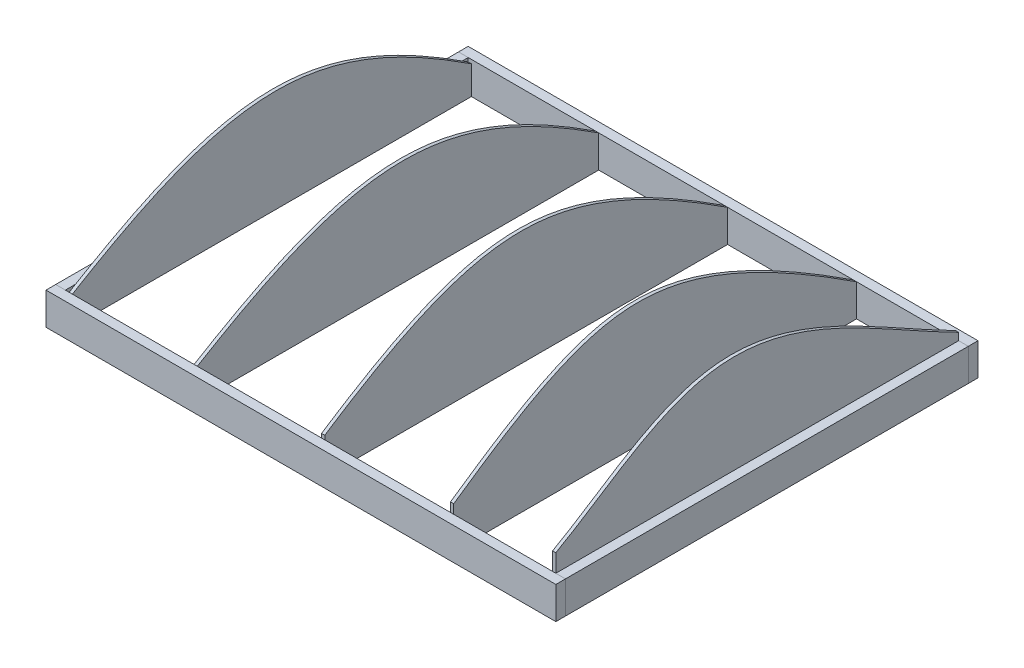
from build123d import *

# Parameters (mm, degrees)
MEMBER_20_X_20_1_DEPTH      = 1567
MEMBER_20_X_20_1_DEPTH_BACK = 15
SKETCH1_W                   = 30
SKETCH1_H                   = 100
SKETCH1_ON_SEGMENT_2_W      = 30
SKETCH1_ON_SEGMENT_2_H      = 100
MEMBER_20_X_20_1_2_DEPTH    = 1582
SKETCH1_ON_SEGMENT_3_W      = 30
SKETCH1_ON_SEGMENT_3_H      = 100
MEMBER_20_X_20_1_3_DEPTH    = 1282
SKETCH1_ON_SEGMENT_4_W      = 30
SKETCH1_ON_SEGMENT_4_H      = 100
MEMBER_20_X_20_1_4_DEPTH    = 1282
EXTRUDE_1_DEPTH             = 5
EXTRUDE_2_DEPTH             = 5
EXTRUDE_4_DEPTH             = 5
EXTRUDE_3_DEPTH             = 5
EXTRUDE_5_DEPTH             = 10
EXTRUDE_6_DEPTH             = 10
THICKEN_START               = 751
THICKEN_1_DEPTH             = 10
CUT_EXTRUDE_1_DEPTH         = 1129.034039006
CUT_EXTRUDE_1_DEPTH_BACK    = 1129.034039006
SKETCH_10_OUTSIDE_W         = 2064.662
SKETCH_10_OUTSIDE_H         = 1746.768
SKETCH_10_OUTSIDE_W_2       = 1522
SKETCH_10_OUTSIDE_H_2       = 1250
DELETE_START                = -761
DELETE_BODY_1_DEPTH         = 10


with BuildPart() as part:
    # Sketch1 → Member 20 X 20_1 (new, two sides: drawn at the far end of the back side and taken through both)
    with BuildSketch(Plane(origin=(-776, 0, -640), x_dir=(0, 0, -1), z_dir=(1, 0, 0)).offset(-MEMBER_20_X_20_1_DEPTH_BACK)):
        Rectangle(SKETCH1_W, SKETCH1_H)
    extrude(amount=MEMBER_20_X_20_1_DEPTH + MEMBER_20_X_20_1_DEPTH_BACK)


with BuildPart() as body_2:
    # Sketch1 on segment 2 (carried to segment 2) → Member 20 X 20_1 2 (new body)
    with BuildSketch(Plane(origin=(-791, 0, 640), x_dir=(0, 0, -1), z_dir=(1, 0, 0))):
        Rectangle(SKETCH1_ON_SEGMENT_2_W, SKETCH1_ON_SEGMENT_2_H)
    extrude(amount=MEMBER_20_X_20_1_2_DEPTH)


with BuildPart() as body_3:
    # Sketch1 on segment 3 (carried to segment 3) → Member 20 X 20_1 3 (new body)
    with BuildSketch(Plane(origin=(-776, 0, -641), x_dir=(1, 0, 0), z_dir=(0, 0, 1))):
        Rectangle(SKETCH1_ON_SEGMENT_3_W, SKETCH1_ON_SEGMENT_3_H)
    extrude(amount=MEMBER_20_X_20_1_3_DEPTH)

    # Member 20 X 20_1 3 end butt 1
    split(bisect_by=Plane(origin=(-776, 0, -625), x_dir=(0, -1, 0), z_dir=(0, 0, 1)), keep=Keep.TOP)

    # Member 20 X 20_1 3 end butt 2
    split(bisect_by=Plane(origin=(-776, 0, 625), x_dir=(0, 1, 0), z_dir=(0, 0, -1)), keep=Keep.TOP)


with BuildPart() as body_4:
    # Sketch1 on segment 4 (carried to segment 4) → Member 20 X 20_1 4 (new body)
    with BuildSketch(Plane(origin=(776, 0, -641), x_dir=(1, 0, 0), z_dir=(0, 0, 1))):
        Rectangle(SKETCH1_ON_SEGMENT_4_W, SKETCH1_ON_SEGMENT_4_H)
    extrude(amount=MEMBER_20_X_20_1_4_DEPTH)

    # Member 20 X 20_1 4 end butt 1
    split(bisect_by=Plane(origin=(776, 0, -625), x_dir=(0, -1, 0), z_dir=(0, 0, 1)), keep=Keep.TOP)

    # Member 20 X 20_1 4 end butt 2
    split(bisect_by=Plane(origin=(776, 0, 625), x_dir=(0, 1, 0), z_dir=(0, 0, -1)), keep=Keep.TOP)


with BuildPart() as body_5:
    # Эскиз4 → Бобышка-Вытянуть1 (new, symmetric)
    with BuildSketch(Plane(origin=(839, 0, 0), x_dir=(0, 0, -1), z_dir=(1, 0, 0))):
        with BuildLine():
            Line((-655, 80.257302063), (-655, -50))
            Line((-655, -50), (655, -50))
            Line((655, -50), (655, 48.860781094))
            add(Edge.make_bspline(
                [(655, 48.860781094), (407.54925547, 168.103359882), (159.338134303, 355.993204105), (-93.417741246, 346.880394236), (-100.140293463, 346.490653549), (-110.221664644, 345.684210073), (-113.581713958, 345.378583956), (-120.300981721, 344.69232081), (-123.655957487, 344.312101465), (-140.390025835, 342.22778496), (-153.664401165, 339.971996727), (-173.416917196, 335.759350508), (-179.974380313, 334.215926486), (-193.038546448, 330.864513272), (-199.55127132, 329.055428998), (-218.934200454, 323.274447734), (-231.671945707, 318.945871487), (-256.83927986, 309.494790773), (-269.265749415, 304.364249686), (-287.709299488, 296.163069915), (-293.824695876, 293.345730388), (-305.998331512, 287.563792758), (-312.057579583, 284.597340757), (-435.114041025, 222.682817953), (-538.304017908, 139.736286366), (-655, 80.257302063)],
                knots=[-2.161817402, -2.161817402, -2.161817402, -2.161817402, 0.125, 0.125, 0.1875, 0.1875, 0.21875, 0.21875, 0.25, 0.25, 0.375, 0.375, 0.4375, 0.4375, 0.5, 0.5, 0.625, 0.625, 0.75, 0.75, 0.8125, 0.8125, 0.875, 0.875, 2.090245738, 2.090245738, 2.090245738, 2.090245738], degree=3))
        make_face()
    extrude(amount=EXTRUDE_1_DEPTH, both=True)


with BuildPart() as body_6:
    # Эскиз5 → Бобышка-Вытянуть2 (new, symmetric)
    with BuildSketch(Plane(origin=(439, 0, 0), x_dir=(0, 0, -1), z_dir=(1, 0, 0))):
        with BuildLine():
            Line((654.999999997, 30.288253077), (655, -50))
            Line((655, -50), (-655, -50))
            Line((-655, -50), (-655, 57.74805179))
            add(Edge.make_bspline(
                [(654.999999997, 30.288253077), (624.45454615, 50.509351242), (593.715633072, 70.410797546), (542.507442256, 102.598074234), (522.184076469, 115.124994313), (481.278871267, 139.751759596), (460.696555479, 151.850817694), (429.583108507, 169.602897995), (419.172280775, 175.454697082), (398.262824285, 187.013221993), (387.765568238, 192.71845378), (366.688265431, 203.955272546), (356.106457613, 209.48770409), (334.847573275, 220.362769279), (324.170539668, 225.705488414), (302.707866351, 236.17455751), (291.922171784, 241.30079818), (270.228869486, 251.310399517), (259.318378906, 256.195071469), (237.395546017, 265.669121937), (226.379439676, 270.260610396), (204.2238994, 279.115396893), (193.084119485, 283.377774234), (170.662722254, 291.525081543), (159.381734125, 295.411685858), (142.338754236, 300.918271499), (136.637400021, 302.699617052), (125.190798931, 306.145504202), (119.444478644, 307.810246171), (102.172363416, 312.606757701), (90.602058306, 315.545184926), (67.337767193, 320.844951913), (55.643209266, 323.203623116), (37.995095843, 326.245750137), (32.094688961, 327.17719413), (20.256728971, 328.866760105), (14.316703035, 329.625509039), (-3.503906295, 331.621718754), (-15.402499497, 332.579794372), (-39.238768043, 333.694981527), (-51.176253721, 333.855980147), (-66.123703442, 333.532723565), (-69.115763359, 333.441750415), (-75.096119791, 333.207018899), (-78.083131438, 333.063336135), (-87.034703986, 332.553646941), (-92.989817302, 332.109122686), (-110.817917781, 330.466056829), (-122.65316104, 328.953829834), (-140.33292008, 326.077914738), (-146.214113233, 325.019048217), (-155.018206569, 323.283675666), (-157.950760231, 322.680449281), (-163.798909569, 321.427869041), (-166.715788638, 320.778277363), (-181.265076839, 317.416631272), (-192.792586837, 314.364881299), (-215.646981573, 307.611695241), (-226.97311986, 303.90784192), (-243.831110454, 297.927141584), (-249.428469722, 295.862426199), (-260.581424921, 291.597752932), (-266.139065193, 289.396962163), (-282.739295629, 282.609727152), (-293.690356034, 277.84623692), (-326.253241329, 262.957251266), (-347.580781665, 252.245634757), (-379.147474896, 235.302759202), (-389.60190056, 229.507331435), (-488.091388176, 173.448656483), (-571.181105103, 114.99498802), (-655, 57.74805179)],
                knots=[-0.033324686, -0.033324686, -0.033324686, -0.033324686, 0.0625, 0.0625, 0.125, 0.125, 0.1875, 0.1875, 0.21875, 0.21875, 0.25, 0.25, 0.28125, 0.28125, 0.3125, 0.3125, 0.34375, 0.34375, 0.375, 0.375, 0.40625, 0.40625, 0.4375, 0.4375, 0.46875, 0.46875, 0.484375, 0.484375, 0.5, 0.5, 0.53125, 0.53125, 0.5625, 0.5625, 0.578125, 0.578125, 0.59375, 0.59375, 0.625, 0.625, 0.65625, 0.65625, 0.6640625, 0.6640625, 0.671875, 0.671875, 0.6875, 0.6875, 0.71875, 0.71875, 0.734375, 0.734375, 0.7421875, 0.7421875, 0.75, 0.75, 0.78125, 0.78125, 0.8125, 0.8125, 0.828125, 0.828125, 0.84375, 0.84375, 0.875, 0.875, 0.9375, 0.9375, 0.96875, 0.96875, 1.233958266, 1.233958266, 1.233958266, 1.233958266], degree=3))
        make_face()
    extrude(amount=EXTRUDE_2_DEPTH, both=True)


with BuildPart() as body_7:
    # Эскиз6 → Бобышка-Вытянуть4 (new, symmetric)
    with BuildSketch(Plane(origin=(39, 0, 0), x_dir=(0, 0, -1), z_dir=(1, 0, 0))):
        with BuildLine():
            Line((655.000000002, 30.256188522), (655, -50))
            Line((655, -50), (-654.999999996, -50))
            Line((-654.999999996, -50), (-654.999999996, 42.412476024))
            add(Edge.make_bspline(
                [(655.000000002, 30.256188522), (622.167632396, 52.060746158), (589.069433143, 73.417486521), (543.951385473, 101.368897759), (532.25612267, 108.510362235), (508.765663168, 122.624943567), (496.970185265, 129.597586711), (473.264854776, 143.350198579), (461.354982231, 150.13013368), (437.408222455, 163.476036245), (425.370968285, 170.041385566), (407.204952916, 179.703878747), (401.130081932, 182.894381169), (388.948219476, 189.206113963), (382.841393184, 192.32745375), (364.470029782, 201.580943815), (352.154423091, 207.602162832), (314.974266971, 225.158976831), (289.879557325, 236.194627171), (258.00427707, 248.88813735), (251.602697885, 251.37172688), (238.766315979, 256.211807998), (232.32903269, 258.569298632), (212.956437878, 265.442759169), (199.960842907, 269.76122966), (173.785247703, 277.794025851), (160.605093931, 281.507848526), (140.679293457, 286.568907852), (134.011547585, 288.171361628), (120.621082972, 291.196168175), (113.894674461, 292.618999728), (80.218961052, 299.234999279), (53.071610473, 302.94832704), (22.262926274, 305.079374343), (18.836021152, 305.287757813), (11.974683432, 305.647026699), (8.540114155, 305.797881293), (-1.755514468, 306.162883112), (-8.614953582, 306.290059715), (-29.180269313, 306.321453894), (-42.873062451, 305.873331141), (-63.386342901, 304.503406202), (-70.219808163, 303.931102501), (-80.463637064, 302.901128856), (-83.877183497, 302.529172138), (-90.702161491, 301.728304845), (-94.112108873, 301.299545164), (-111.128175477, 299.018830302), (-124.65329635, 296.753723448), (-151.542125413, 291.413000485), (-164.905387722, 288.335145447), (-184.839640005, 283.162795012), (-191.469843239, 281.345278794), (-204.659580333, 277.544572191), (-211.222657111, 275.560564749), (-230.822573266, 269.37352874), (-243.770452854, 264.936419001), (-269.460635389, 255.521262747), (-282.202040462, 250.540853642), (-307.502558329, 240.100367139), (-320.061720768, 234.640420369), (-345.023429191, 223.308419698), (-357.43334635, 217.434393662), (-394.358000117, 199.328371568), (-418.597474761, 186.59748297), (-454.536652967, 166.765505887), (-466.446292537, 160.032097858), (-490.145265088, 146.354577683), (-501.934184524, 139.409741257), (-561.517621953, 103.677290546), (-608.484245157, 73.439707131), (-654.999999996, 42.412476024)],
                knots=[-0.027273286, -0.027273286, -0.027273286, -0.027273286, 0.0625, 0.0625, 0.09375, 0.09375, 0.125, 0.125, 0.15625, 0.15625, 0.1875, 0.1875, 0.203125, 0.203125, 0.21875, 0.21875, 0.25, 0.25, 0.3125, 0.3125, 0.328125, 0.328125, 0.34375, 0.34375, 0.375, 0.375, 0.40625, 0.40625, 0.421875, 0.421875, 0.4375, 0.4375, 0.5, 0.5, 0.5078125, 0.5078125, 0.515625, 0.515625, 0.53125, 0.53125, 0.5625, 0.5625, 0.578125, 0.578125, 0.5859375, 0.5859375, 0.59375, 0.59375, 0.625, 0.625, 0.65625, 0.65625, 0.671875, 0.671875, 0.6875, 0.6875, 0.71875, 0.71875, 0.75, 0.75, 0.78125, 0.78125, 0.8125, 0.8125, 0.875, 0.875, 0.90625, 0.90625, 0.9375, 0.9375, 1.064909144, 1.064909144, 1.064909144, 1.064909144], degree=3))
        make_face()
    extrude(amount=EXTRUDE_4_DEPTH, both=True)


with BuildPart() as body_8:
    # Эскиз9 → Бобышка-Вытянуть3 (new, symmetric)
    with BuildSketch(Plane(origin=(-361, 0, 0), x_dir=(0, 0, -1), z_dir=(1, 0, 0))):
        with BuildLine():
            Line((655, 30.204010373), (655, -50))
            Line((655, -50), (-655.000000001, -50))
            Line((-655.000000001, -50), (-655.000000001, 24.912697624))
            add(Edge.make_bspline(
                [(655, 30.204010373), (625.627362749, 49.812751725), (595.987006161, 68.956883079), (546.156128338, 99.691549979), (526.173104659, 111.642184428), (485.814351422, 134.86193708), (465.440316387, 146.133996019), (434.517708589, 162.414628135), (424.149897524, 167.736901824), (403.280541806, 178.149363003), (392.775163202, 183.240639384), (361.097366819, 198.096985903), (339.747748178, 207.455457855), (307.300640963, 220.494925665), (296.414317993, 224.674630592), (279.96792764, 230.668091734), (274.465522047, 232.62013462), (263.436803325, 236.422167642), (257.908512019, 238.272858428), (230.194388302, 247.263820004), (207.790445393, 253.616220234), (179.446988501, 260.333870402), (173.761358038, 261.616212158), (162.354989007, 264.054076269), (156.632196924, 265.209983988), (139.422944804, 268.47833035), (127.920544211, 270.386714391), (93.321084978, 275.267754301), (70.131499034, 277.393829007), (40.982091537, 278.565309643), (35.140045183, 278.725529147), (23.467516021, 278.896729931), (17.635699711, 278.907869082), (0.153504321, 278.719430741), (-11.483606474, 278.297750603), (-34.723310485, 276.87658802), (-46.325927145, 275.877498011), (-63.704857178, 273.960463333), (-69.49366463, 273.2516616), (-78.170740975, 272.08576578), (-81.063072404, 271.679872769), (-86.839755339, 270.835126659), (-89.724107544, 270.396289567), (-115.648019334, 266.301242623), (-138.44121208, 261.628255062), (-183.596480552, 250.503021917), (-205.959345405, 244.05403313), (-233.685457196, 235.054011351), (-239.221666162, 233.20623843), (-250.253774987, 229.427647938), (-255.751289064, 227.496648997), (-272.190775994, 221.584312268), (-283.079665007, 217.483570371), (-315.553601039, 204.747825295), (-336.946246668, 195.680044154), (-460.499988148, 140.076912831), (-558.063496756, 83.199982313), (-655.000000001, 24.912697624)],
                knots=[-0.03210545, -0.03210545, -0.03210545, -0.03210545, 0.0625, 0.0625, 0.125, 0.125, 0.1875, 0.1875, 0.21875, 0.21875, 0.25, 0.25, 0.3125, 0.3125, 0.34375, 0.34375, 0.359375, 0.359375, 0.375, 0.375, 0.4375, 0.4375, 0.453125, 0.453125, 0.46875, 0.46875, 0.5, 0.5, 0.5625, 0.5625, 0.578125, 0.578125, 0.59375, 0.59375, 0.625, 0.625, 0.65625, 0.65625, 0.671875, 0.671875, 0.6796875, 0.6796875, 0.6875, 0.6875, 0.75, 0.75, 0.8125, 0.8125, 0.828125, 0.828125, 0.84375, 0.84375, 0.875, 0.875, 0.9375, 0.9375, 1.239502448, 1.239502448, 1.239502448, 1.239502448], degree=3))
        make_face()
    extrude(amount=EXTRUDE_3_DEPTH, both=True)


with BuildPart() as body_9:
    # Эскиз11 → Бобышка-Вытянуть5 (new body)
    with BuildSketch(Plane(origin=(-761, 0, 0), x_dir=(0, 0, -1), z_dir=(1, 0, 0))):
        with BuildLine():
            Line((655, -50), (655, 30.204010373))
            add(Edge.make_bspline(
                [(655, 30.204010373), (625.627362749, 49.812751725), (595.987006161, 68.956883079), (546.156128338, 99.691549979), (526.173104659, 111.642184428), (485.814351422, 134.86193708), (465.440316387, 146.133996019), (434.517708589, 162.414628135), (424.149897524, 167.736901824), (403.280541806, 178.149363003), (392.775163202, 183.240639384), (361.097366819, 198.096985903), (339.747748178, 207.455457855), (307.300640963, 220.494925665), (296.414317993, 224.674630592), (279.96792764, 230.668091734), (274.465522047, 232.62013462), (263.436803325, 236.422167642), (257.908512019, 238.272858428), (230.194388302, 247.263820004), (207.790445393, 253.616220234), (179.446988501, 260.333870402), (173.761358038, 261.616212158), (162.354989007, 264.054076269), (156.632196924, 265.209983988), (139.422944804, 268.47833035), (127.920544211, 270.386714391), (93.321084978, 275.267754301), (70.131499034, 277.393829007), (40.982091537, 278.565309643), (35.140045183, 278.725529147), (23.467516021, 278.896729931), (17.635699711, 278.907869082), (0.153504321, 278.719430741), (-11.483606474, 278.297750603), (-34.723310485, 276.87658802), (-46.325927145, 275.877498011), (-63.704857178, 273.960463333), (-69.49366463, 273.2516616), (-78.170740975, 272.08576578), (-81.063072404, 271.679872769), (-86.839755339, 270.835126659), (-89.724107544, 270.396289567), (-115.648019334, 266.301242623), (-138.44121208, 261.628255062), (-183.596480552, 250.503021917), (-205.959345405, 244.05403313), (-233.685457196, 235.054011351), (-239.221666162, 233.20623843), (-250.253774987, 229.427647938), (-255.751289064, 227.496648997), (-272.190775994, 221.584312268), (-283.079665007, 217.483570371), (-315.553601039, 204.747825295), (-336.946246668, 195.680044154), (-460.499988148, 140.076912831), (-558.063496756, 83.199982313), (-655.000000001, 24.912697624)],
                knots=[-0.03210545, -0.03210545, -0.03210545, -0.03210545, 0.0625, 0.0625, 0.125, 0.125, 0.1875, 0.1875, 0.21875, 0.21875, 0.25, 0.25, 0.3125, 0.3125, 0.34375, 0.34375, 0.359375, 0.359375, 0.375, 0.375, 0.4375, 0.4375, 0.453125, 0.453125, 0.46875, 0.46875, 0.5, 0.5, 0.5625, 0.5625, 0.578125, 0.578125, 0.59375, 0.59375, 0.625, 0.625, 0.65625, 0.65625, 0.671875, 0.671875, 0.6796875, 0.6796875, 0.6875, 0.6875, 0.75, 0.75, 0.8125, 0.8125, 0.828125, 0.828125, 0.84375, 0.84375, 0.875, 0.875, 0.9375, 0.9375, 1.239502448, 1.239502448, 1.239502448, 1.239502448], degree=3))
            Line((-655.000000001, 24.912697624), (-655.000000001, -50))
            Line((-655.000000001, -50), (655, -50))
        make_face()
    extrude(amount=EXTRUDE_5_DEPTH)


with BuildPart() as body_10:
    # Эскиз12 → Бобышка-Вытянуть6 (new body)
    with BuildSketch(Plane.ZY.offset(-761)):
        with BuildLine():
            Line((655, -50), (655, 80.257302063))
            add(Edge.make_bspline(
                [(655, 80.257302063), (538.304017908, 139.736286366), (435.114041025, 222.682817953), (312.057579583, 284.597340757), (305.998331512, 287.563792758), (293.824695876, 293.345730388), (287.709299488, 296.163069915), (269.265749415, 304.364249686), (256.83927986, 309.494790773), (231.671945707, 318.945871487), (218.934200454, 323.274447734), (199.55127132, 329.055428998), (193.038546448, 330.864513272), (179.974380313, 334.215926486), (173.416917196, 335.759350508), (153.664401165, 339.971996727), (140.390025835, 342.22778496), (123.655957487, 344.312101465), (120.300981721, 344.69232081), (113.581713958, 345.378583956), (110.221664644, 345.684210073), (100.140293463, 346.490653549), (93.417741246, 346.880394236), (-159.338134303, 355.993204105), (-407.54925547, 168.103359882), (-655, 48.860781094)],
                knots=[-2.161817402, -2.161817402, -2.161817402, -2.161817402, -0.946571664, -0.946571664, -0.884071664, -0.884071664, -0.821571664, -0.821571664, -0.696571664, -0.696571664, -0.571571664, -0.571571664, -0.509071664, -0.509071664, -0.446571664, -0.446571664, -0.321571664, -0.321571664, -0.290321664, -0.290321664, -0.259071664, -0.259071664, -0.196571664, -0.196571664, 2.090245738, 2.090245738, 2.090245738, 2.090245738], degree=3))
            Line((-655, 48.860781094), (-655, -50))
            Line((-655, -50), (655, -50))
        make_face()
    extrude(amount=EXTRUDE_6_DEPTH)

    # Придать толщину1: read off the stored shape, not the designer's step
    # Придать толщину1 outline → Придать толщину1 (add)
    with BuildSketch(Plane.YZ.offset(THICKEN_START)):
        with BuildLine():
            add(Edge.make_bspline(
                [(87.3848746, 658.632865223), (98.440058955, 636.942925311), (110.094609525, 615.566533015), (122.263703742, 594.453825747), (134.861997451, 573.555289119), (147.803626127, 552.821504401), (161.002261008, 532.202975746), (174.371183376, 511.650016677), (187.82334987, 491.112682107), (201.271430495, 470.54073477), (214.627810782, 449.883642743), (227.804558331, 429.090606917), (240.713363627, 408.110624754), (253.265474015, 386.892599773), (266.884921045, 362.697126585), (268.391225187, 360.004224148), (269.890387289, 357.306705474), (271.382232938, 354.6044709), (272.866587598, 351.897420817), (274.343276605, 349.185455646), (275.812125178, 346.468475884), (277.272958402, 343.746382036), (278.725601248, 341.019074698), (280.169878555, 338.286454473), (281.605615045, 335.548422043), (283.032635309, 332.804878115), (284.450763819, 330.055723455), (286.035957557, 326.956500801), (286.211948517, 326.612053511), (286.387797455, 326.267516812), (286.563504029, 325.922890508), (286.739067895, 325.578174408), (286.914488711, 325.233368317), (287.08976613, 324.888472042), (287.264899815, 324.543485389), (287.439889415, 324.198408165), (287.614734595, 323.853240176), (287.789435005, 323.507981229), (287.963990306, 323.162631131), (288.138400153, 322.817189688), (288.486928252, 322.126123724), (288.661048222, 321.780495456), (288.835011593, 321.434797707), (289.00884591, 321.088971784), (289.182539096, 320.743041307), (289.35607895, 320.397030861), (289.529470854, 320.050929014), (289.702722923, 319.704718153), (289.875831311, 319.358405189), (290.048786679, 319.012008353), (290.221591151, 318.665522766), (290.394254449, 318.318927776), (290.566763528, 317.972249031), (291.083843233, 316.931928683), (291.427962214, 316.238011271), (291.771474843, 315.543728302), (292.114375588, 314.849084733), (292.456658916, 314.154085511), (292.798319301, 313.458735607), (293.139351204, 312.763039953), (293.479749103, 312.067003533), (293.819507457, 311.370631271), (294.158620744, 310.67392815), (294.497083426, 309.976899106), (294.834889975, 309.279549104), (295.172034859, 308.581883095), (295.59263197, 307.709411772), (295.676709692, 307.534898065), (295.760745627, 307.360364995), (295.84473969, 307.185812636), (295.928691792, 307.01124107), (296.012601849, 306.836650367), (296.096469774, 306.662040615), (296.180295479, 306.487411878), (296.264078879, 306.312764247), (296.347819888, 306.138097787), (296.431518417, 305.963412584), (296.515174382, 305.788708711), (296.598787696, 305.613986246), (296.724143559, 305.351874778), (296.765918163, 305.264499659), (296.807682071, 305.177119924), (296.849435272, 305.089735574), (296.891177759, 305.002346634), (296.932909514, 304.914953089), (296.974630536, 304.827554983), (297.016340803, 304.740152285), (297.058040314, 304.652745045), (297.099729052, 304.56533324), (297.141407008, 304.477916901), (297.183074173, 304.390496027), (297.224730533, 304.303070631), (297.287198854, 304.171925768), (297.308018922, 304.128209684), (297.328836291, 304.084492478), (297.34965094, 304.040774134), (297.370462907, 303.99705469), (297.391272126, 303.953334084), (297.412078684, 303.909612404), (297.43288248, 303.865889553), (297.453683606, 303.822165626), (297.474481986, 303.778440549), (297.49527767, 303.734714373), (297.516070627, 303.690987072), (297.536860869, 303.64725866), (297.568042151, 303.581664369), (297.578434674, 303.559800499), (297.588828918, 303.53793131), (297.599218974, 303.516069198), (297.609609044, 303.494205374), (297.620001147, 303.472335548), (297.630392042, 303.450466573), (297.640779379, 303.428603323), (297.651165839, 303.40674026), (297.661554972, 303.38486986), (297.671944567, 303.362996764), (297.68232904, 303.341132678), (297.692712523, 303.319269062), (297.713479428, 303.275538554), (297.723862222, 303.253673001), (297.734244357, 303.231807151), (297.744625831, 303.209940999), (297.75500665, 303.188074555), (297.765386802, 303.166207802), (297.775766304, 303.144340764), (297.786145137, 303.122473413), (297.796523318, 303.100605775), (297.806900833, 303.07873783), (297.817277691, 303.05686959), (297.827653888, 303.03500105), (297.838029425, 303.013132211), (298.014402319, 302.641356867), (298.180231246, 302.2913741), (298.345890552, 301.941314568), (298.511379706, 301.591178063), (298.676698186, 301.240964381), (298.841845446, 300.890673312), (299.006820982, 300.540304659), (299.171624231, 300.1898582), (299.336254701, 299.839333749), (299.500711828, 299.48873108), (299.664995108, 299.138050004), (299.829103997, 298.787290303), (299.993037972, 298.436451777), (300.484313557, 297.383699098), (300.811128841, 296.681547845), (301.137238105, 295.979078808), (301.462637109, 295.276290351), (301.787321598, 294.573180814), (302.111287339, 293.869748572), (302.434530074, 293.165991954), (302.757045569, 292.461909343), (303.07882957, 291.757499068), (303.399877837, 291.052759502), (303.720186121, 290.347688988), (304.03975018, 289.642285888), (304.358565767, 288.936548553), (304.756144353, 288.053957036), (304.835613024, 287.877417739), (304.915034586, 287.700857428), (304.994408963, 287.524276066), (305.073736108, 287.347673649), (305.15301592, 287.171050115), (305.232248383, 286.994405489), (305.31143337, 286.817739687), (305.390570876, 286.64105274), (305.469660781, 286.464344575), (305.548703058, 286.2876152), (305.627697617, 286.11086457), (305.706644402, 285.934092668), (305.805268079, 285.713101164), (305.824989826, 285.668901533), (305.844708576, 285.624700566), (305.864424346, 285.580498279), (305.884137099, 285.536294636), (305.903846896, 285.492089696), (305.923553648, 285.447883378), (305.943257455, 285.403675773), (305.962958221, 285.359466793), (305.98265602, 285.315256508), (306.0023508, 285.271044871), (306.022042589, 285.226831907), (306.041731373, 285.182617604), (306.081102936, 285.094186328), (306.100788551, 285.049962982), (306.120444157, 285.005798972), (306.140222427, 284.961351437), (306.159626889, 284.917734551), (306.179785764, 284.872418638), (306.198836939, 284.829573977), (306.219038245, 284.784151909), (306.238384183, 284.740627737), (306.258172769, 284.696112339), (306.277795787, 284.651954965), (306.297455171, 284.607709721), (306.31710585, 284.563475429), (306.376049798, 284.430766343), (306.415333579, 284.342288304), (306.454605166, 284.253804946), (306.493864558, 284.165316274), (306.533111734, 284.076822268), (306.572346711, 283.988322952), (306.611569449, 283.899818288), (306.650779977, 283.811308314), (306.689978256, 283.722792988), (306.729164303, 283.634272339), (306.768338094, 283.545746343), (306.807499632, 283.457215008), (306.846648906, 283.368678328), (307.042333924, 282.925968191), (307.198685613, 282.571714523), (307.35484052, 282.217375123), (307.510798192, 281.862949818), (307.666558177, 281.508438431), (307.822120012, 281.153840792), (307.977483258, 280.799156725), (308.132647439, 280.444386055), (308.287612126, 280.089528613), (308.44237684, 279.734584217), (308.596941146, 279.379552701), (308.751304577, 279.024433886), (308.905466684, 278.6692276), (309.367347669, 277.603345806), (309.674461214, 276.892407355), (309.980764009, 276.181116932), (310.286252405, 275.469473148), (310.590922771, 274.757474624), (310.894771444, 274.045119961), (311.197794811, 273.332407794), (311.499989196, 272.619336712), (311.801350988, 271.905905356), (312.101876519, 271.192112317), (312.401562165, 270.477956225), (312.700404272, 269.763435686), (312.998399203, 269.048549318), (313.889831536, 266.902788568), (314.480716442, 265.470812578), (315.068168853, 264.037356711), (315.652159576, 262.602409922), (316.232659408, 261.165961195), (316.80963913, 259.727999511), (317.383069509, 258.28851389), (317.952921304, 256.847493342), (318.519165254, 255.404926918), (319.081772093, 253.960803665), (319.640712532, 252.515112659), (320.19595728, 251.067842985), (320.747477024, 249.618983746), (321.312360112, 248.123197195), (321.329474115, 248.077868768), (321.34658445, 248.032538775), (321.36369112, 247.987207222), (321.380794114, 247.9418741), (321.397893449, 247.896539422), (321.414989101, 247.851203169), (321.432081092, 247.805865361), (321.449169402, 247.760525979), (321.466254044, 247.715185038), (321.483335009, 247.669842528), (321.5004123, 247.624498452), (321.517485914, 247.57915281), (321.54309082, 247.511131996), (321.551624869, 247.488458), (321.560157999, 247.465783612), (321.568690209, 247.443108833), (321.577221501, 247.420433659), (321.585751871, 247.397758098), (321.594281323, 247.37508214), (321.602809854, 247.352405795), (321.611337466, 247.329729053), (321.619864157, 247.307051923), (321.628389928, 247.284374398), (321.636914778, 247.261696483), (321.645438708, 247.239018175), (321.658223222, 247.205000124), (321.662484469, 247.193660752), (321.666745525, 247.182321178), (321.671006375, 247.170981425), (321.675266994, 247.159641612), (321.679527326, 247.148301792), (321.683787408, 247.136962008), (321.688047227, 247.125622128), (321.69230688, 247.114282059), (321.696566376, 247.102941635), (321.700825738, 247.091600889), (321.705084842, 247.0802601), (321.7093434, 247.068920061), (321.717858292, 247.04624451), (321.722115513, 247.034906637), (321.726372508, 247.023568666), (321.73062928, 247.0122306), (321.734885822, 247.000892431), (321.739142147, 246.989554175), (321.743398234, 246.978215807), (321.747654112, 246.966877358), (321.751909748, 246.955538796), (321.756165172, 246.944200149), (321.760420362, 246.932861397), (321.76467533, 246.921522551), (321.768930072, 246.910183606), (321.807220724, 246.808132228), (321.841242431, 246.717413655), (321.875249705, 246.626688842), (321.909242532, 246.535957784), (321.943220914, 246.445220484), (321.977184826, 246.354476927), (322.011134284, 246.263727128), (322.045069251, 246.172971062), (322.078989748, 246.082208748), (322.112895742, 245.991440165), (322.146787243, 245.900665322), (322.180664231, 245.809884209), (322.214526704, 245.719096827), (322.316070549, 245.446715857), (322.383708345, 245.265103449), (322.45128798, 245.083465923), (322.518809378, 244.901803252), (322.586272496, 244.720115417), (322.653677228, 244.538402383), (322.72102357, 244.356664144), (322.788311382, 244.174900652), (322.855540675, 243.993111907), (322.922711318, 243.811297863), (322.989823293, 243.629458513), (323.056876507, 243.447593822), (323.123870908, 243.26570377), (323.324677462, 242.719957456), (323.458312971, 242.356025034), (323.591712427, 241.991990875), (323.724875315, 241.627854783), (323.8578011, 241.263616564), (323.990489279, 240.899276029), (324.122939303, 240.534832977), (324.255150681, 240.170287223), (324.387122859, 239.805638565), (324.518855341, 239.440886816), (324.650347586, 239.076031779), (324.781599082, 238.711073262), (324.912609303, 238.34601107), (325.304914573, 237.250512891), (325.565484239, 236.519765288), (325.825082535, 235.788600665), (326.08370528, 235.057017483), (326.341348275, 234.325014211), (326.598007352, 233.592589301), (326.853678298, 232.859741235), (327.108356957, 232.126468452), (327.362039112, 231.39276944), (327.6147206, 230.658642643), (327.866397218, 229.924086537), (328.117064788, 229.189099577), (328.366719119, 228.453680231), (328.863992932, 226.981973691), (329.111612413, 226.245686495), (329.35821027, 225.508963854), (329.603782316, 224.771804252), (329.848324333, 224.034206161), (330.091832166, 223.296168077), (330.33430156, 222.557688461), (330.57572839, 221.818765818), (330.816108389, 221.079398603), (331.05543742, 220.33958532), (331.293711246, 219.599324435), (331.530925696, 218.858614436), (331.767076561, 218.117453801), (332.119701196, 217.005034618), (332.236975795, 216.634115189), (332.353982922, 216.263082535), (332.470722057, 215.891936475), (332.587192662, 215.520676806), (332.703394233, 215.149303365), (332.819326217, 214.777815929), (332.93498812, 214.406214351), (333.050379386, 214.034498402), (333.165499516, 213.662667929), (333.280347967, 213.290722718), (333.394924223, 212.918662597), (333.509227754, 212.54648737), (333.68027318, 211.988051594), (333.737220009, 211.801877512), (333.794098462, 211.615674585), (333.850908468, 211.429442786), (333.907649971, 211.2431821), (333.96432289, 211.056892487), (334.020927179, 210.870573949), (334.077462751, 210.684226433), (334.13392956, 210.497849944), (334.190327525, 210.311444435), (334.246656591, 210.125009899), (334.302916685, 209.938546303), (334.359107746, 209.752053629), (334.443290686, 209.472270962), (334.471334762, 209.379001583), (334.499359531, 209.285731542), (334.52737145, 209.192439727), (334.555361957, 209.099153976), (334.583334541, 209.00586305), (334.611293825, 208.912551739), (334.639235292, 208.819234609), (334.667155116, 208.725924226), (334.69505918, 208.632601676), (334.722950978, 208.539255127), (334.750819879, 208.445918763), (334.778670922, 208.352577848), (334.834348391, 208.165846139), (334.862169768, 208.072472443), (334.889973775, 207.979090932), (334.917760397, 207.885701626), (334.945529629, 207.79230456), (334.973281446, 207.698899742), (335.001015854, 207.60548722), (335.02873282, 207.512066995), (335.056432349, 207.418639113), (335.084114418, 207.325203582), (335.11177902, 207.23176044), (335.139426141, 207.138309704), (335.167055768, 207.044851402), (335.415564862, 206.20365881), (335.63534152, 205.455449435), (335.853991535, 204.706770222), (336.071508582, 203.957633956), (336.287886335, 203.208053429), (336.503118465, 202.458041421), (336.717198649, 201.70761073), (336.930120556, 200.95677413), (337.141877864, 200.205544423), (337.352464243, 199.453934383), (337.561873368, 198.701956808), (337.770098912, 197.949624479), (337.977134549, 197.196950187), (338.285893654, 196.067444982), (338.388514289, 195.690860947), (338.490835061, 195.314196209), (338.592855179, 194.937452362), (338.69457384, 194.560631002), (338.795990263, 194.183733724), (338.897103631, 193.806762123), (338.997913177, 193.429717796), (339.098418076, 193.052602336), (339.198617559, 192.67541734), (339.298510813, 192.298164403), (339.398097054, 191.920845121), (339.49737548, 191.543461088), (339.645830209, 190.977290306), (339.695237967, 190.788550923), (339.744568471, 190.599795949), (339.793821627, 190.411025587), (339.842997324, 190.222240028), (339.892095482, 190.033439484), (339.941115976, 189.844624139), (339.990058732, 189.655794207), (340.038923627, 189.466949875), (340.08771058, 189.278091351), (340.13641948, 189.089218828), (340.185050233, 188.900332509), (340.233602736, 188.711432591), (340.330551046, 188.333605958), (340.378955549, 188.14464486), (340.427270387, 187.955712321), (340.475514473, 187.766735926), (340.523683171, 187.577733113), (340.571769503, 187.388730435), (340.619776128, 187.199717428), (340.667708038, 187.010675028), (340.715563634, 186.821608943), (340.763338082, 186.632537611), (340.811032754, 186.443455487), (340.858653525, 186.254340034), (340.906193361, 186.065217868), (341.143503913, 185.119511386), (341.332099328, 184.362675957), (341.519438693, 183.605569799), (341.705518977, 182.848192422), (341.890337161, 182.090543342), (342.073890206, 181.332622066), (342.256175101, 180.574428115), (342.437188802, 179.81596099), (342.6169283, 179.057220217), (342.795390552, 178.298205297), (342.972572544, 177.53891575), (343.148471243, 176.779351085), (343.323083624, 176.019510815), (343.583068177, 174.879336273), (343.669407358, 174.499209072), (343.755423825, 174.119012794), (343.841117194, 173.738747377), (343.9264871, 173.358412765), (344.011533138, 172.978008894), (344.09625497, 172.597535712), (344.180652168, 172.216993152), (344.264724404, 171.836381162), (344.348471256, 171.455699677), (344.431892376, 171.074948643), (344.514987368, 170.694127997), (344.597755862, 170.313237682), (344.700807879, 169.837037627), (344.721397852, 169.741793258), (344.741967393, 169.646544532), (344.762516479, 169.55129144), (344.783045145, 169.456034), (344.803553315, 169.360772178), (344.824041078, 169.26550602), (344.844508322, 169.17023547), (344.86495514, 169.074960581), (344.885381448, 168.979681308), (344.905787292, 168.88439768), (344.926172638, 168.78910968), (344.946537493, 168.693817314), (344.987226198, 168.503223842), (345.007554243, 168.40790303), (345.027835189, 168.312701725), (345.048141299, 168.217287589), (345.068387053, 168.122050729), (345.088622049, 168.02676707), (345.108855016, 167.931395326), (345.129048534, 167.836105294), (345.149220035, 167.740818878), (345.169389648, 167.645444651), (345.18951988, 167.550151385), (345.209639955, 167.454808052), (345.229736489, 167.359474441), (345.289966121, 167.073455238), (345.330037524, 166.882758956), (345.370027209, 166.692045856), (345.409935152, 166.501315936), (345.449761309, 166.310569187), (345.489505671, 166.119805614), (345.529168179, 165.929025202), (345.568748833, 165.738227957), (345.608247574, 165.547413868), (345.647664394, 165.356582935), (345.686999248, 165.165735151), (345.726252112, 164.974870515), (345.765422953, 164.783989021), (346.117222047, 163.06590382), (346.424680971, 161.537637843), (346.726872831, 160.008290697), (347.023781963, 158.477860371), (347.315392684, 156.946344858), (347.601689369, 155.4137422), (347.882656323, 153.880050417), (348.158277959, 152.345267603), (348.428538587, 150.809391813), (348.693422625, 149.272421175), (348.952914422, 147.734353798), (349.206998382, 146.195187834), (349.455658893, 144.654921446), (349.820491094, 142.342868504), (349.940742061, 141.571908617), (350.059631311, 140.800672935), (350.177156915, 140.029161243), (350.293316891, 139.257373308), (350.408109354, 138.48530893), (350.521532277, 137.712967862), (350.633583805, 136.940349914), (350.744261907, 136.167454836), (350.853564706, 135.394282431), (350.961490211, 134.620832463), (351.068036501, 133.847104721), (351.17320162, 133.07309898), (351.328874628, 131.911673041), (351.38042007, 131.524459473), (351.431618535, 131.137185402), (351.482472206, 130.749827666), (351.532978993, 130.362404197), (351.583137893, 129.974921868), (351.632950155, 129.587366078), (351.68241645, 129.199728557), (351.731535205, 128.812022636), (351.780304633, 128.424262562), (351.828725711, 128.036434921), (351.876800845, 127.648514725), (351.924527884, 127.260525914), (352.019286151, 126.48440357), (352.066317398, 126.096270162), (352.113000585, 125.708065905), (352.159335531, 125.319792186), (352.205322079, 124.931450395), (352.250960021, 124.543041914), (352.296249232, 124.154568137), (352.341189475, 123.766030444), (352.385780641, 123.377430231), (352.430022498, 122.988768876), (352.473914913, 122.600047774), (352.517457686, 122.211268307), (352.560650655, 121.822431866), (352.624915133, 121.239093821), (352.64624913, 121.044633909), (352.667495607, 120.850160273), (352.688654547, 120.655673088), (352.709725919, 120.461172524), (352.730709716, 120.26665876), (352.751605892, 120.072131961), (352.772414455, 119.877592312), (352.793135353, 119.683039973), (352.813768588, 119.488475129), (352.834314122, 119.293897946), (352.854771942, 119.099308601), (352.875142021, 118.904707266), (352.915706656, 118.515480965), (352.935900426, 118.320863901), (352.956011691, 118.126182331), (352.976020161, 117.931638608), (352.995961239, 117.736881877), (353.015807203, 117.542182853), (353.035553162, 117.347593703), (353.055219276, 117.152918628), (353.074799666, 116.958210537), (353.094282586, 116.763586172), (353.113682772, 116.568905798), (353.132992139, 116.374243517), (353.152213162, 116.179578636), (353.209610249, 115.595583636), (353.24752038, 115.206253201), (353.285076214, 114.816922355), (353.322278048, 114.427591122), (353.359126174, 114.038259526), (353.3956209, 113.64892759), (353.431762501, 113.25959534), (353.467551302, 112.870262798), (353.50298757, 112.480929988), (353.538071626, 112.091596935), (353.572803749, 111.702263662), (353.607184245, 111.312930194), (353.641213407, 110.923596553), (353.691730594, 110.33959587), (353.708481898, 110.144928938), (353.725145477, 109.950261972), (353.741721378, 109.755594976), (353.758209617, 109.560927949), (353.774610268, 109.3662609), (353.790923316, 109.171593823), (353.807148859, 108.976926733), (353.823286874, 108.78225962), (353.839337449, 108.587592498), (353.855300585, 108.392925362), (353.871176339, 108.19825822), (353.88696474, 108.003591071), (353.9065911, 107.760257133), (353.910510902, 107.711590338), (353.914425169, 107.662925279), (353.918334444, 107.614253267), (353.922237738, 107.565588075), (353.926135116, 107.516929397), (353.930027698, 107.4682629), (353.93391572, 107.419583981), (353.937798151, 107.370906256), (353.941674082, 107.322241448), (353.945544477, 107.273577892), (353.949410606, 107.224898659), (353.953270394, 107.176230411), (353.960979432, 107.078888636), (353.96482848, 107.030217678), (353.968672052, 106.981546647), (353.972510162, 106.932875548), (353.976342781, 106.884204372), (353.980169958, 106.835533135), (353.983991626, 106.786861813), (353.987807861, 106.738190434), (353.991618591, 106.689518973), (353.995423872, 106.640847449), (353.999223669, 106.592175849), (354.003018, 106.54350418), (354.006806858, 106.49483244), (354.018157019, 106.348817007), (354.025701907, 106.251473102), (354.033224909, 106.154128914), (354.04072603, 106.056784444), (354.048205257, 105.959439689), (354.055662618, 105.862094657), (354.063098072, 105.764749336), (354.070511668, 105.66740374), (354.077903359, 105.570057857), (354.085273185, 105.472711698), (354.092621119, 105.375365254), (354.099947177, 105.278018532), (354.107251352, 105.180671529), (354.143662827, 104.693935114), (354.17244192, 104.304541501), (354.200870959, 103.915143428), (354.228949959, 103.525740906), (354.256678975, 103.136333964), (354.284057991, 102.746922603), (354.311087096, 102.357506862), (354.33776625, 101.968086734), (354.364095545, 101.578662261), (354.390074958, 101.189233441), (354.415704552, 100.799800305), (354.440984337, 100.410362863), (354.465914348, 100.020921135), (354.53965514, 98.852583147), (354.587416671, 98.073674082), (354.633779443, 97.294748085), (354.678743679, 96.515805297), (354.722309635, 95.736845863), (354.764477503, 94.957869917), (354.805247575, 94.178877612), (354.844620017, 93.399869076), (354.882595128, 92.620844466), (354.919173087, 91.841803909), (354.954354165, 91.062747557), (354.988138574, 90.283675545), (355.020526557, 89.504588019), (355.055392318, 88.628097256), (355.059244476, 88.530709154), (355.063074818, 88.433320811), (355.06688335, 88.335932229), (355.070670058, 88.238543406), (355.074434969, 88.141154347), (355.078178044, 88.043765046), (355.081899332, 87.946375509), (355.085598785, 87.848985731), (355.089276444, 87.751595718), (355.09293228, 87.654205465), (355.096566312, 87.556814975), (355.10017853, 87.459424248), (355.10735935, 87.264642321), (355.110928164, 87.167245258), (355.114473726, 87.069886322), (355.118001531, 86.97242366), (355.12150215, 86.875088852), (355.124982917, 86.777718036), (355.128444464, 86.680284856), (355.131881474, 86.582908982), (355.135296438, 86.485546419), (355.138692186, 86.388128831), (355.142063843, 86.290756509), (355.145414905, 86.193364631), (355.148743924, 86.095977465), (355.15866591, 85.803814644), (355.165193655, 85.609039616), (355.171634525, 85.414264776), (355.177988553, 85.219490126), (355.184255785, 85.024715673), (355.190436238, 84.829941411), (355.196529979, 84.635167353), (355.202537008, 84.440393491), (355.208457398, 84.245619838), (355.214291155, 84.050846388), (355.220038337, 83.85607315), (355.225698968, 83.661300122), (355.23127309, 83.466527309), (355.247736036, 82.882209523), (355.258365438, 82.492665201), (355.26864924, 82.10312177), (355.27858773, 81.713579248), (355.288181212, 81.324037659), (355.297429958, 80.934497016), (355.306334291, 80.544957351), (355.314894471, 80.155418671), (355.323110821, 79.765881009), (355.33098361, 79.376344374), (355.338513147, 78.986808795), (355.345699717, 78.597274287), (355.352543615, 78.207740873), (355.411057291, 74.701950171), (355.441157057, 71.585762995), (355.449494723, 68.469657205), (355.436220667, 65.353642608), (355.401485348, 62.237728645), (355.345439327, 59.121924407), (355.268233227, 56.00623862), (355.170017792, 52.890679659), (355.050943814, 49.775255533), (354.91116221, 46.659973902), (354.750823954, 43.54484206), (354.570080125, 40.429866947), (354.369081882, 37.315055144), (350.610357909, -15.633863433), (341.926295823, -65.424729252), (328.714530579, -115.146592642), (311.595435712, -164.795905365), (291.175330683, -214.386234499), (268.047655561, -263.927125769), (242.802009539, -313.423656507), (216.026749307, -362.878411015), (188.308204627, -412.290434269), (160.232192984, -461.655512156), (132.385370825, -510.967447188), (105.352944352, -560.21658713), (79.719795509, -609.390257126), (56.06765992, -658.472880301)],
                knots=[-2.161817402, -2.161817402, -2.161817402, -2.161817402, -2.161817402, -2.161817402, -2.161817402, -2.161817402, -2.161817402, -2.161817402, -2.161817402, -2.161817402, -2.161817402, -2.161817402, -2.161817402, -1.098801617, -1.098801617, -1.098801617, -1.098801617, -1.098801617, -1.098801617, -1.098801617, -1.098801617, -1.098801617, -1.098801617, -1.098801617, -1.098801617, -1.098801617, -0.965924644, -0.965924644, -0.965924644, -0.965924644, -0.965924644, -0.965924644, -0.965924644, -0.965924644, -0.965924644, -0.965924644, -0.965924644, -0.965924644, -0.965924644, -0.949315022, -0.949315022, -0.949315022, -0.949315022, -0.949315022, -0.949315022, -0.949315022, -0.949315022, -0.949315022, -0.949315022, -0.949315022, -0.949315022, -0.949315022, -0.9327054, -0.9327054, -0.9327054, -0.9327054, -0.9327054, -0.9327054, -0.9327054, -0.9327054, -0.9327054, -0.9327054, -0.9327054, -0.9327054, -0.9327054, -0.899486157, -0.899486157, -0.899486157, -0.899486157, -0.899486157, -0.899486157, -0.899486157, -0.899486157, -0.899486157, -0.899486157, -0.899486157, -0.899486157, -0.899486157, -0.891181346, -0.891181346, -0.891181346, -0.891181346, -0.891181346, -0.891181346, -0.891181346, -0.891181346, -0.891181346, -0.891181346, -0.891181346, -0.891181346, -0.891181346, -0.887028941, -0.887028941, -0.887028941, -0.887028941, -0.887028941, -0.887028941, -0.887028941, -0.887028941, -0.887028941, -0.887028941, -0.887028941, -0.887028941, -0.887028941, -0.884952738, -0.884952738, -0.884952738, -0.884952738, -0.884952738, -0.884952738, -0.884952738, -0.884952738, -0.884952738, -0.884952738, -0.884952738, -0.884952738, -0.884952738, -0.883914637, -0.883914637, -0.883914637, -0.883914637, -0.883914637, -0.883914637, -0.883914637, -0.883914637, -0.883914637, -0.883914637, -0.883914637, -0.883914637, -0.883914637, -0.882876536, -0.882876536, -0.882876536, -0.882876536, -0.882876536, -0.882876536, -0.882876536, -0.882876536, -0.882876536, -0.882876536, -0.882876536, -0.882876536, -0.882876536, -0.866266914, -0.866266914, -0.866266914, -0.866266914, -0.866266914, -0.866266914, -0.866266914, -0.866266914, -0.866266914, -0.866266914, -0.866266914, -0.866266914, -0.866266914, -0.833047671, -0.833047671, -0.833047671, -0.833047671, -0.833047671, -0.833047671, -0.833047671, -0.833047671, -0.833047671, -0.833047671, -0.833047671, -0.833047671, -0.833047671, -0.82474286, -0.82474286, -0.82474286, -0.82474286, -0.82474286, -0.82474286, -0.82474286, -0.82474286, -0.82474286, -0.82474286, -0.82474286, -0.82474286, -0.82474286, -0.822666657, -0.822666657, -0.822666657, -0.822666657, -0.822666657, -0.822666657, -0.822666657, -0.822666657, -0.822666657, -0.822666657, -0.822666657, -0.822666657, -0.822666657, -0.820590454, -0.820590454, -0.820590454, -0.820590454, -0.820590454, -0.820590454, -0.820590454, -0.820590454, -0.820590454, -0.820590454, -0.820590454, -0.820590454, -0.820590454, -0.816438049, -0.816438049, -0.816438049, -0.816438049, -0.816438049, -0.816438049, -0.816438049, -0.816438049, -0.816438049, -0.816438049, -0.816438049, -0.816438049, -0.816438049, -0.799828427, -0.799828427, -0.799828427, -0.799828427, -0.799828427, -0.799828427, -0.799828427, -0.799828427, -0.799828427, -0.799828427, -0.799828427, -0.799828427, -0.799828427, -0.766609184, -0.766609184, -0.766609184, -0.766609184, -0.766609184, -0.766609184, -0.766609184, -0.766609184, -0.766609184, -0.766609184, -0.766609184, -0.766609184, -0.766609184, -0.700170698, -0.700170698, -0.700170698, -0.700170698, -0.700170698, -0.700170698, -0.700170698, -0.700170698, -0.700170698, -0.700170698, -0.700170698, -0.700170698, -0.700170698, -0.698094495, -0.698094495, -0.698094495, -0.698094495, -0.698094495, -0.698094495, -0.698094495, -0.698094495, -0.698094495, -0.698094495, -0.698094495, -0.698094495, -0.698094495, -0.697056393, -0.697056393, -0.697056393, -0.697056393, -0.697056393, -0.697056393, -0.697056393, -0.697056393, -0.697056393, -0.697056393, -0.697056393, -0.697056393, -0.697056393, -0.696537343, -0.696537343, -0.696537343, -0.696537343, -0.696537343, -0.696537343, -0.696537343, -0.696537343, -0.696537343, -0.696537343, -0.696537343, -0.696537343, -0.696537343, -0.696018292, -0.696018292, -0.696018292, -0.696018292, -0.696018292, -0.696018292, -0.696018292, -0.696018292, -0.696018292, -0.696018292, -0.696018292, -0.696018292, -0.696018292, -0.691865887, -0.691865887, -0.691865887, -0.691865887, -0.691865887, -0.691865887, -0.691865887, -0.691865887, -0.691865887, -0.691865887, -0.691865887, -0.691865887, -0.691865887, -0.683561076, -0.683561076, -0.683561076, -0.683561076, -0.683561076, -0.683561076, -0.683561076, -0.683561076, -0.683561076, -0.683561076, -0.683561076, -0.683561076, -0.683561076, -0.666951454, -0.666951454, -0.666951454, -0.666951454, -0.666951454, -0.666951454, -0.666951454, -0.666951454, -0.666951454, -0.666951454, -0.666951454, -0.666951454, -0.666951454, -0.633732211, -0.633732211, -0.633732211, -0.633732211, -0.633732211, -0.633732211, -0.633732211, -0.633732211, -0.633732211, -0.633732211, -0.633732211, -0.633732211, -0.633732211, -0.600512968, -0.600512968, -0.600512968, -0.600512968, -0.600512968, -0.600512968, -0.600512968, -0.600512968, -0.600512968, -0.600512968, -0.600512968, -0.600512968, -0.600512968, -0.583903346, -0.583903346, -0.583903346, -0.583903346, -0.583903346, -0.583903346, -0.583903346, -0.583903346, -0.583903346, -0.583903346, -0.583903346, -0.583903346, -0.583903346, -0.575598535, -0.575598535, -0.575598535, -0.575598535, -0.575598535, -0.575598535, -0.575598535, -0.575598535, -0.575598535, -0.575598535, -0.575598535, -0.575598535, -0.575598535, -0.57144613, -0.57144613, -0.57144613, -0.57144613, -0.57144613, -0.57144613, -0.57144613, -0.57144613, -0.57144613, -0.57144613, -0.57144613, -0.57144613, -0.57144613, -0.567293724, -0.567293724, -0.567293724, -0.567293724, -0.567293724, -0.567293724, -0.567293724, -0.567293724, -0.567293724, -0.567293724, -0.567293724, -0.567293724, -0.567293724, -0.534074481, -0.534074481, -0.534074481, -0.534074481, -0.534074481, -0.534074481, -0.534074481, -0.534074481, -0.534074481, -0.534074481, -0.534074481, -0.534074481, -0.534074481, -0.517464859, -0.517464859, -0.517464859, -0.517464859, -0.517464859, -0.517464859, -0.517464859, -0.517464859, -0.517464859, -0.517464859, -0.517464859, -0.517464859, -0.517464859, -0.509160049, -0.509160049, -0.509160049, -0.509160049, -0.509160049, -0.509160049, -0.509160049, -0.509160049, -0.509160049, -0.509160049, -0.509160049, -0.509160049, -0.509160049, -0.500855238, -0.500855238, -0.500855238, -0.500855238, -0.500855238, -0.500855238, -0.500855238, -0.500855238, -0.500855238, -0.500855238, -0.500855238, -0.500855238, -0.500855238, -0.467635995, -0.467635995, -0.467635995, -0.467635995, -0.467635995, -0.467635995, -0.467635995, -0.467635995, -0.467635995, -0.467635995, -0.467635995, -0.467635995, -0.467635995, -0.451026373, -0.451026373, -0.451026373, -0.451026373, -0.451026373, -0.451026373, -0.451026373, -0.451026373, -0.451026373, -0.451026373, -0.451026373, -0.451026373, -0.451026373, -0.446873967, -0.446873967, -0.446873967, -0.446873967, -0.446873967, -0.446873967, -0.446873967, -0.446873967, -0.446873967, -0.446873967, -0.446873967, -0.446873967, -0.446873967, -0.442721562, -0.442721562, -0.442721562, -0.442721562, -0.442721562, -0.442721562, -0.442721562, -0.442721562, -0.442721562, -0.442721562, -0.442721562, -0.442721562, -0.442721562, -0.434416751, -0.434416751, -0.434416751, -0.434416751, -0.434416751, -0.434416751, -0.434416751, -0.434416751, -0.434416751, -0.434416751, -0.434416751, -0.434416751, -0.434416751, -0.367978265, -0.367978265, -0.367978265, -0.367978265, -0.367978265, -0.367978265, -0.367978265, -0.367978265, -0.367978265, -0.367978265, -0.367978265, -0.367978265, -0.367978265, -0.334759021, -0.334759021, -0.334759021, -0.334759021, -0.334759021, -0.334759021, -0.334759021, -0.334759021, -0.334759021, -0.334759021, -0.334759021, -0.334759021, -0.334759021, -0.3181494, -0.3181494, -0.3181494, -0.3181494, -0.3181494, -0.3181494, -0.3181494, -0.3181494, -0.3181494, -0.3181494, -0.3181494, -0.3181494, -0.3181494, -0.301539778, -0.301539778, -0.301539778, -0.301539778, -0.301539778, -0.301539778, -0.301539778, -0.301539778, -0.301539778, -0.301539778, -0.301539778, -0.301539778, -0.301539778, -0.293234967, -0.293234967, -0.293234967, -0.293234967, -0.293234967, -0.293234967, -0.293234967, -0.293234967, -0.293234967, -0.293234967, -0.293234967, -0.293234967, -0.293234967, -0.284930157, -0.284930157, -0.284930157, -0.284930157, -0.284930157, -0.284930157, -0.284930157, -0.284930157, -0.284930157, -0.284930157, -0.284930157, -0.284930157, -0.284930157, -0.268320535, -0.268320535, -0.268320535, -0.268320535, -0.268320535, -0.268320535, -0.268320535, -0.268320535, -0.268320535, -0.268320535, -0.268320535, -0.268320535, -0.268320535, -0.260015724, -0.260015724, -0.260015724, -0.260015724, -0.260015724, -0.260015724, -0.260015724, -0.260015724, -0.260015724, -0.260015724, -0.260015724, -0.260015724, -0.260015724, -0.257939521, -0.257939521, -0.257939521, -0.257939521, -0.257939521, -0.257939521, -0.257939521, -0.257939521, -0.257939521, -0.257939521, -0.257939521, -0.257939521, -0.257939521, -0.255863319, -0.255863319, -0.255863319, -0.255863319, -0.255863319, -0.255863319, -0.255863319, -0.255863319, -0.255863319, -0.255863319, -0.255863319, -0.255863319, -0.255863319, -0.251710913, -0.251710913, -0.251710913, -0.251710913, -0.251710913, -0.251710913, -0.251710913, -0.251710913, -0.251710913, -0.251710913, -0.251710913, -0.251710913, -0.251710913, -0.235101292, -0.235101292, -0.235101292, -0.235101292, -0.235101292, -0.235101292, -0.235101292, -0.235101292, -0.235101292, -0.235101292, -0.235101292, -0.235101292, -0.235101292, -0.201882048, -0.201882048, -0.201882048, -0.201882048, -0.201882048, -0.201882048, -0.201882048, -0.201882048, -0.201882048, -0.201882048, -0.201882048, -0.201882048, -0.201882048, -0.197729643, -0.197729643, -0.197729643, -0.197729643, -0.197729643, -0.197729643, -0.197729643, -0.197729643, -0.197729643, -0.197729643, -0.197729643, -0.197729643, -0.197729643, -0.193577237, -0.193577237, -0.193577237, -0.193577237, -0.193577237, -0.193577237, -0.193577237, -0.193577237, -0.193577237, -0.193577237, -0.193577237, -0.193577237, -0.193577237, -0.185272427, -0.185272427, -0.185272427, -0.185272427, -0.185272427, -0.185272427, -0.185272427, -0.185272427, -0.185272427, -0.185272427, -0.185272427, -0.185272427, -0.185272427, -0.168662805, -0.168662805, -0.168662805, -0.168662805, -0.168662805, -0.168662805, -0.168662805, -0.168662805, -0.168662805, -0.168662805, -0.168662805, -0.168662805, -0.168662805, -0.035785832, -0.035785832, -0.035785832, -0.035785832, -0.035785832, -0.035785832, -0.035785832, -0.035785832, -0.035785832, -0.035785832, -0.035785832, -0.035785832, -0.035785832, 2.090245738, 2.090245738, 2.090245738, 2.090245738, 2.090245738, 2.090245738, 2.090245738, 2.090245738, 2.090245738, 2.090245738, 2.090245738, 2.090245738, 2.090245738, 2.090245738, 2.090245738], degree=14))
            Line((87.3848746, 658.632865223), (80.257302063, 655))
            add(Edge.make_bspline(
                [(80.257302063, 655), (139.736286366, 538.304017908), (222.682817953, 435.114041025), (284.597340757, 312.057579583), (287.563792758, 305.998331512), (293.345730388, 293.824695876), (296.163069915, 287.709299488), (304.364249686, 269.265749415), (309.494790773, 256.83927986), (318.945871487, 231.671945707), (323.274447734, 218.934200454), (329.055428998, 199.55127132), (330.864513272, 193.038546448), (334.215926486, 179.974380313), (335.759350508, 173.416917196), (339.971996727, 153.664401165), (342.22778496, 140.390025835), (344.312101465, 123.655957487), (344.69232081, 120.300981721), (345.378583956, 113.581713958), (345.684210073, 110.221664644), (346.490653549, 100.140293463), (346.880394236, 93.417741246), (355.993204105, -159.338134303), (168.103359882, -407.54925547), (48.860781094, -655)],
                knots=[-2.161817402, -2.161817402, -2.161817402, -2.161817402, -0.946571664, -0.946571664, -0.884071664, -0.884071664, -0.821571664, -0.821571664, -0.696571664, -0.696571664, -0.571571664, -0.571571664, -0.509071664, -0.509071664, -0.446571664, -0.446571664, -0.321571664, -0.321571664, -0.290321664, -0.290321664, -0.259071664, -0.259071664, -0.196571664, -0.196571664, 2.090245738, 2.090245738, 2.090245738, 2.090245738], degree=3))
            Line((48.860781094, -655), (56.06765992, -658.472880301))
        make_face()
    extrude(amount=THICKEN_1_DEPTH)


with BuildPart() as cut_extrude_1_tool:
    # Эскиз10 outside → Cut-Extrude 1 (new, two sides: drawn at the far end of the back side and taken through both)
    with BuildSketch(Plane(origin=(0, 0, 0), x_dir=(1, 0, 0), z_dir=(0, 1, 0)).offset(-CUT_EXTRUDE_1_DEPTH_BACK)):
        with Locations((26.5, -0.08)):
            Rectangle(SKETCH_10_OUTSIDE_W, SKETCH_10_OUTSIDE_H)
        Rectangle(SKETCH_10_OUTSIDE_W_2, SKETCH_10_OUTSIDE_H_2, mode=Mode.SUBTRACT)
    extrude(amount=CUT_EXTRUDE_1_DEPTH + CUT_EXTRUDE_1_DEPTH_BACK)


with BuildPart() as body_5_1:
    add(body_5.part)

    # Cut-Extrude 1: cut by cut_extrude_1_tool
    add(cut_extrude_1_tool.part, mode=Mode.SUBTRACT)


with BuildPart() as body_6_1:
    add(body_6.part)

    # Cut-Extrude 1: cut by cut_extrude_1_tool
    add(cut_extrude_1_tool.part, mode=Mode.SUBTRACT)


with BuildPart() as body_7_1:
    add(body_7.part)

    # Cut-Extrude 1: cut by cut_extrude_1_tool
    add(cut_extrude_1_tool.part, mode=Mode.SUBTRACT)


with BuildPart() as body_8_1:
    add(body_8.part)

    # Cut-Extrude 1: cut by cut_extrude_1_tool
    add(cut_extrude_1_tool.part, mode=Mode.SUBTRACT)


with BuildPart() as body_9_1:
    add(body_9.part)

    # Cut-Extrude 1: cut by cut_extrude_1_tool
    add(cut_extrude_1_tool.part, mode=Mode.SUBTRACT)

    # Delete Body 1: read off the stored shape, not the designer's step
    # Delete Body 1 outline → Delete Body 1 (cut)
    with BuildSketch(Plane.YZ.offset(DELETE_START)):
        with BuildLine():
            add(Edge.make_bspline(
                [(41.622811853, -619.53898962), (49.286585383, -607.782756449), (64.460010352, -584.156105565), (94.027683922, -536.514753932), (122.319302049, -488.17666095), (148.970235002, -438.964251474), (168.033931178, -401.546187972), (186.026918679, -363.591215776), (202.746124746, -325.169951029), (218.053799535, -286.182738113), (231.758648536, -246.594635555), (243.60182066, -206.582400908), (253.427561598, -166.045841534), (261.044547952, -124.946472524), (266.234133057, -83.67223234), (268.478840615, -49.04552332), (268.988979891, -21.221180853), (268.643768048, 6.528145561), (267.028481957, 34.218286336), (264.188593417, 61.839171273), (260.543403361, 89.449721777), (254.55370705, 123.691095745), (245.273331623, 164.300314111), (234.088650881, 204.488757032), (221.151583794, 244.351728471), (206.746149142, 283.653293313), (185.816541891, 335.327582218), (156.79740874, 398.763180813), (118.429113952, 473.429472366), (84.196908112, 534.759847866), (55.903967767, 583.47202393), (41.516413923, 607.761872292), (34.292177898, 619.879086826)],
                knots=[-2.08e-07, -2.08e-07, -2.08e-07, -2.08e-07, 0.037761464, 0.075523136, 0.151046479, 0.188808151, 0.226569823, 0.264331494, 0.302093166, 0.339854838, 0.377616509, 0.415378181, 0.453139853, 0.490901525, 0.528663196, 0.566424868, 0.585305704, 0.60418654, 0.641948211, 0.660829047, 0.679709883, 0.717471555, 0.755233226, 0.792994898, 0.83075657, 0.868518242, 0.906279913, 0.981803257, 1.0573266, 1.132849944, 1.170611615, 1.208373287, 1.208373287, 1.208373287, 1.208373287], degree=3))
            Line((41.622811853, -619.53898962), (38.062832549, -625))
            Line((38.062832549, -625), (50.000005037, -625))
            add(Edge.make_bspline(
                [(50.000005037, -625), (62.732941394, -605.467668025), (75.237657813, -585.80383029), (99.691549979, -546.156128338), (111.642184428, -526.173104659), (134.86193708, -485.814351422), (146.133996019, -465.440316387), (162.414628135, -434.517708589), (167.736901824, -424.149897524), (178.149363003, -403.280541806), (183.240639384, -392.775163202), (198.096985903, -361.097366819), (207.455457855, -339.747748178), (220.494925665, -307.300640963), (224.674630592, -296.414317993), (230.668091734, -279.96792764), (232.62013462, -274.465522047), (236.422167642, -263.436803325), (238.272858428, -257.908512019), (247.263820004, -230.194388302), (253.616220234, -207.790445393), (260.333870402, -179.446988501), (261.616212158, -173.761358038), (264.054076269, -162.354989007), (265.209983988, -156.632196924), (268.47833035, -139.422944804), (270.386714391, -127.920544211), (275.267754301, -93.321084978), (277.393829007, -70.131499034), (278.565309643, -40.982091537), (278.725529147, -35.140045183), (278.896729931, -23.467516021), (278.907869082, -17.635699711), (278.719430741, -0.153504321), (278.297750603, 11.483606474), (276.87658802, 34.723310485), (275.877498011, 46.325927145), (273.960463333, 63.704857178), (273.2516616, 69.49366463), (272.08576578, 78.170740975), (271.679872769, 81.063072404), (270.835126659, 86.839755339), (270.396289567, 89.724107544), (266.301242623, 115.648019334), (261.628255062, 138.44121208), (250.503021917, 183.596480552), (244.05403313, 205.959345405), (235.054011351, 233.685457196), (233.20623843, 239.221666162), (229.427647938, 250.253774987), (227.496648997, 255.751289064), (221.584312268, 272.190775994), (217.483570371, 283.079665007), (204.747825295, 315.553601039), (195.680044154, 336.946246668), (144.825519729, 449.948277567), (94.810429303, 537.899561985), (42.881488009, 625.000000008)],
                knots=[-2.08e-07, -2.08e-07, -2.08e-07, -2.08e-07, 0.0625, 0.0625, 0.125, 0.125, 0.1875, 0.1875, 0.21875, 0.21875, 0.25, 0.25, 0.3125, 0.3125, 0.34375, 0.34375, 0.359375, 0.359375, 0.375, 0.375, 0.4375, 0.4375, 0.453125, 0.453125, 0.46875, 0.46875, 0.5, 0.5, 0.5625, 0.5625, 0.578125, 0.578125, 0.59375, 0.59375, 0.625, 0.625, 0.65625, 0.65625, 0.671875, 0.671875, 0.6796875, 0.6796875, 0.6875, 0.6875, 0.75, 0.75, 0.8125, 0.8125, 0.828125, 0.828125, 0.84375, 0.84375, 0.875, 0.875, 0.9375, 0.9375, 1.208373287, 1.208373287, 1.208373287, 1.208373287], degree=3))
            Line((42.881488009, 625.000000008), (31.239109445, 625))
            Line((31.239109445, 625), (34.292177898, 619.879086826))
        make_face()
    extrude(amount=DELETE_BODY_1_DEPTH, mode=Mode.SUBTRACT)


with BuildPart() as body_10_1:
    add(body_10.part)

    # Cut-Extrude 1: cut by cut_extrude_1_tool
    add(cut_extrude_1_tool.part, mode=Mode.SUBTRACT)


solid = Compound([part.part, body_2.part, body_3.part, body_4.part, body_6_1.part, body_7_1.part, body_8_1.part, body_9_1.part, body_10_1.part])
